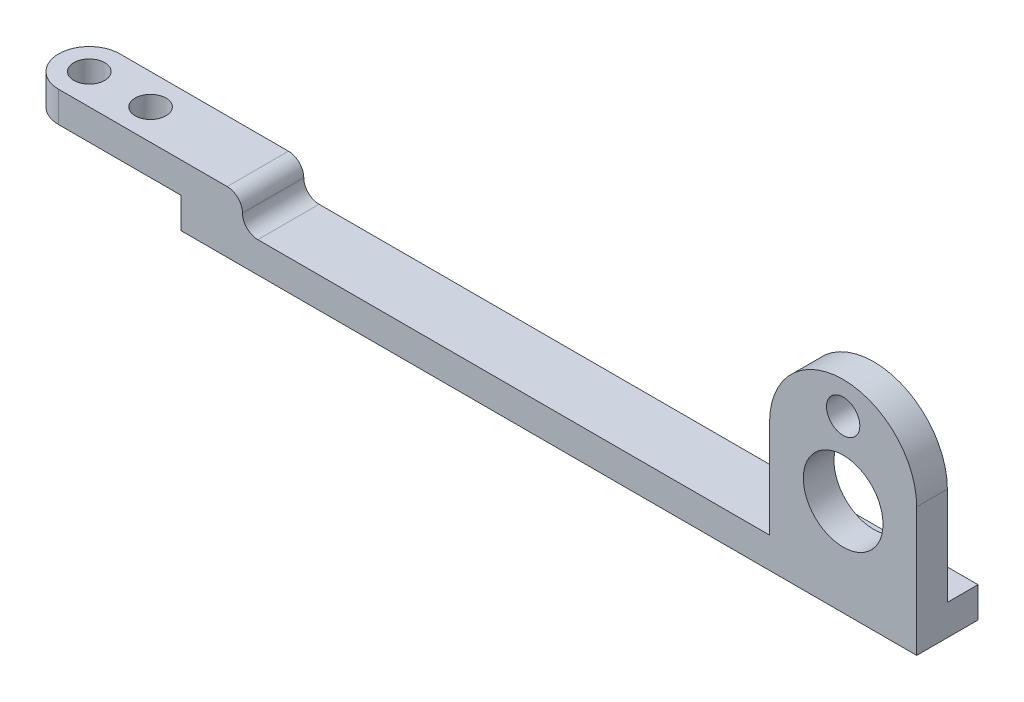
from build123d import *

# Parameters (mm, degrees)
SKETCH2_W           = 76.2
SKETCH2_H           = 6.35
BOSS_EXTRUDE1_DEPTH = 3.175
SKETCH3_R           = 1.6
BOSS_EXTRUDE2_DEPTH = 3.175
FILLET1_START       = -4
FILLET1_DEPTH       = 8
FILLET1_START_2     = -3.175
FILLET1_2_DEPTH     = 6.35
SKETCH6_R           = 4.1275
SKETCH6_R_2         = 1.725
BOSS_EXTRUDE4_DEPTH = 3.175
CHAMFER2_SIZE       = 0.254


with BuildPart() as part:
    # Sketch2 → Boss-Extrude1 (new body)
    with BuildSketch(Plane(origin=(0, 0, 0), x_dir=(1, 0, 0), z_dir=(0, 1, 0))):
        with Locations((38.1, 0)):
            Rectangle(SKETCH2_W, SKETCH2_H)
    extrude(amount=BOSS_EXTRUDE1_DEPTH)

    # Sketch3 → Boss-Extrude2 (add)
    with BuildSketch(Plane(origin=(0, 3.175, 0), x_dir=(1, 0, 0), z_dir=(0, 1, 0))):
        with BuildLine():
            Line((6.35, 3.175), (-12.7, 3.175))
            ThreePointArc((-12.7, 3.175), (-15.875, 0), (-12.7, -3.175))
            Line((-12.7, -3.175), (6.35, -3.175))
            Line((6.35, -3.175), (6.35, 3.175))
        make_face()
        with Locations(Location((-12.7, 0, 0), (0, 0, 270))):
            Circle(SKETCH3_R, mode=Mode.SUBTRACT)
        with Locations(Location((-6.35, 0, 0), (0, 0, 270))):
            Circle(SKETCH3_R, mode=Mode.SUBTRACT)
    extrude(amount=BOSS_EXTRUDE2_DEPTH)

    # Fillet1: read off the stored shape, not the designer's step
    # Fillet1 outline → Fillet1 (cut)
    with BuildSketch(Plane.XY.offset(FILLET1_START)):
        with BuildLine():
            ThreePointArc((4.7625, 6.35), (5.885032015, 5.885032015), (6.35, 4.7625))
            Line((6.35, 4.7625), (6.35, 6.35))
            Line((6.35, 6.35), (4.7625, 6.35))
        make_face()
    extrude(amount=FILLET1_DEPTH, mode=Mode.SUBTRACT)

    # Fillet1 2 outline → Fillet1 2 (add)
    with BuildSketch(Plane.XY.offset(FILLET1_START_2)):
        with BuildLine():
            ThreePointArc((7.9375, 3.175), (6.814967985, 3.639967985), (6.35, 4.7625))
            Line((6.35, 4.7625), (6.35, 3.175))
            Line((6.35, 3.175), (7.9375, 3.175))
        make_face()
    extrude(amount=FILLET1_2_DEPTH)

    # Sketch6 → Boss-Extrude4 (add)
    with BuildSketch(Plane.XY.offset(3.175)):
        with BuildLine():
            Line((76.2, 3.175), (60.96, 3.175))
            Line((60.96, 3.175), (60.96, 13.335))
            ThreePointArc((60.96, 13.335), (68.58, 20.955), (76.2, 13.335))
            Line((76.2, 13.335), (76.2, 3.175))
        make_face()
        with Locations((68.58, 10.033)):
            Circle(SKETCH6_R, mode=Mode.SUBTRACT)
        with Locations((68.58, 17.653)):
            Circle(SKETCH6_R_2, mode=Mode.SUBTRACT)
    extrude(amount=-BOSS_EXTRUDE4_DEPTH)

    # Chamfer2
    chamfer2_edges = [part.edges().sort_by_distance(p)[0] for p in [
        (66.855, 17.653, 0),
    ]]
    chamfer(chamfer2_edges, length=CHAMFER2_SIZE)


solid = part.part
